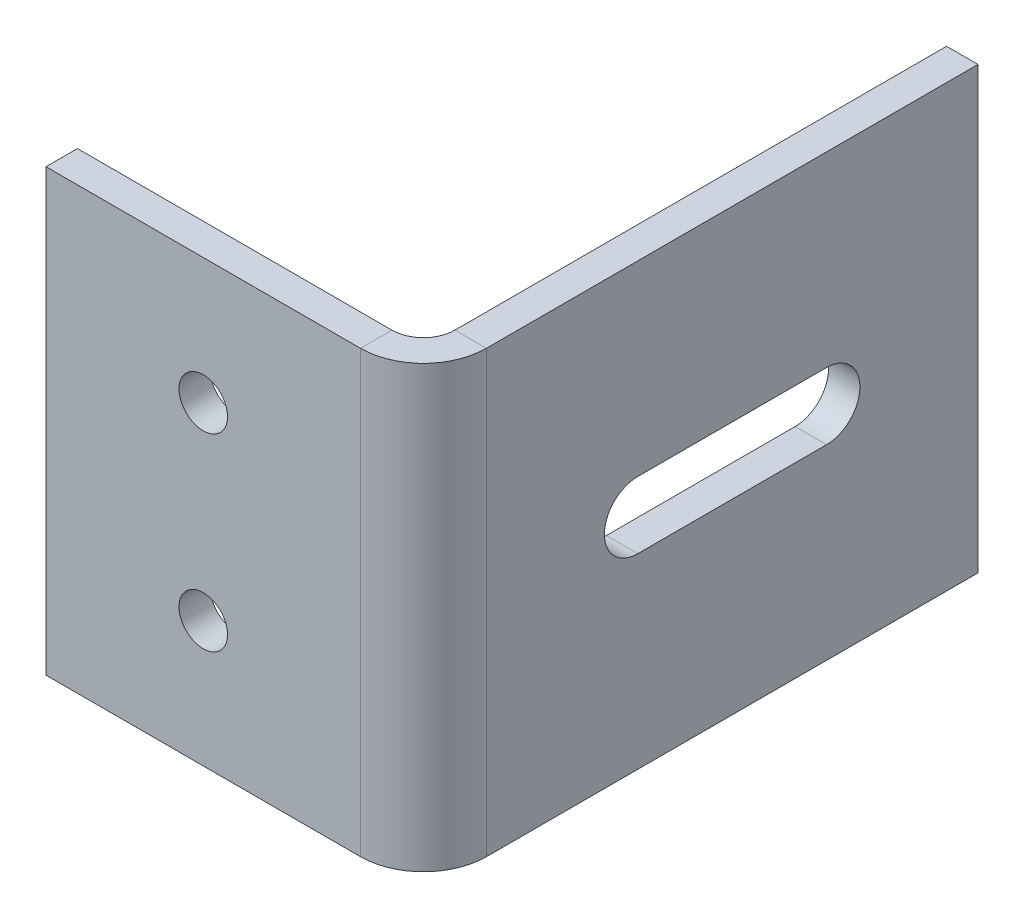
from build123d import *

# Parameters (mm, degrees)
SKETCH1_W                    = 38.1
SKETCH1_H                    = 44.45
BASE_FLANGE1_DEPTH           = 3.175
EDGE_FLANGE1_STRIP_W         = 19.05
EDGE_FLANGE1_STRIP_H         = 3.175
EDGE_FLANGE1_STRIP_CUT_DEPTH = 44.45
EDGE_FLANGE1_DEPTH           = 44.45
SKETCH9_R                    = 2.4511
CUT_EXTRUDE1_DEPTH           = 61.377066247
CUT_EXTRUDE3_DEPTH           = 70.625037081


# Sheet-metal steps are written as plain solids
with BuildPart() as part:
    # Sketch1 → Base-Flange1 (new body)
    with BuildSketch(Plane.XY):
        Rectangle(SKETCH1_W, SKETCH1_H)
    extrude(amount=-BASE_FLANGE1_DEPTH)

    # Edge-Flange1 strip (across the edge) → Edge-Flange1 strip cut (cut)
    with BuildSketch(Plane(origin=(19.05, 22.225, -3.175), x_dir=(-1, 0, 0), z_dir=(0, -1, 0))):
        with Locations((-3.175, -1.5875)):
            Rectangle(EDGE_FLANGE1_STRIP_W, EDGE_FLANGE1_STRIP_H)
    extrude(amount=EDGE_FLANGE1_STRIP_CUT_DEPTH, mode=Mode.SUBTRACT)

    # Edge-Flange1 section (across the edge) → Edge-Flange1 (add)
    with BuildSketch(Plane(origin=(19.05, 22.225, -3.175), x_dir=(-1, 0, 0), z_dir=(0, -1, 0))):
        with BuildLine():
            Line((0, 3.175), (0, 52.8066))
            Line((0, 52.8066), (3.175, 52.8066))
            Line((3.175, 52.8066), (3.175, 3.175))
            ThreePointArc((3.175, 3.175), (4.10493597, 0.92993597), (6.35, 0))
            Line((6.35, 0), (6.35, -3.175))
            ThreePointArc((6.35, -3.175), (1.859871939, -1.315128061), (0, 3.175))
        make_face()
    extrude(amount=EDGE_FLANGE1_DEPTH)

    # Sketch9 → Cut-Extrude1 (cut, through all)
    with BuildSketch(Plane(origin=(0, 0, -3.175), x_dir=(-1, 0, 0), z_dir=(0, 0, -1))):
        with Locations((3.175, 9.525)):
            Circle(SKETCH9_R)
        with Locations((3.175, -9.525)):
            Circle(SKETCH9_R)
    extrude(amount=-CUT_EXTRUDE1_DEPTH, mode=Mode.SUBTRACT)

    # Sketch12 → Cut-Extrude3 (cut, through all)
    with BuildSketch(Plane.ZY.offset(-15.875)):
        with BuildLine():
            Line((-40.6908, 3.3734375), (-21.6408, 3.3734375))
            ThreePointArc((-21.6408, 3.3734375), (-18.2673625, 0), (-21.6408, -3.3734375))
            Line((-21.6408, -3.3734375), (-40.6908, -3.3734375))
            ThreePointArc((-40.6908, -3.3734375), (-44.0642375, 0), (-40.6908, 3.3734375))
        make_face()
    extrude(amount=-CUT_EXTRUDE3_DEPTH, mode=Mode.SUBTRACT)


solid = part.part
